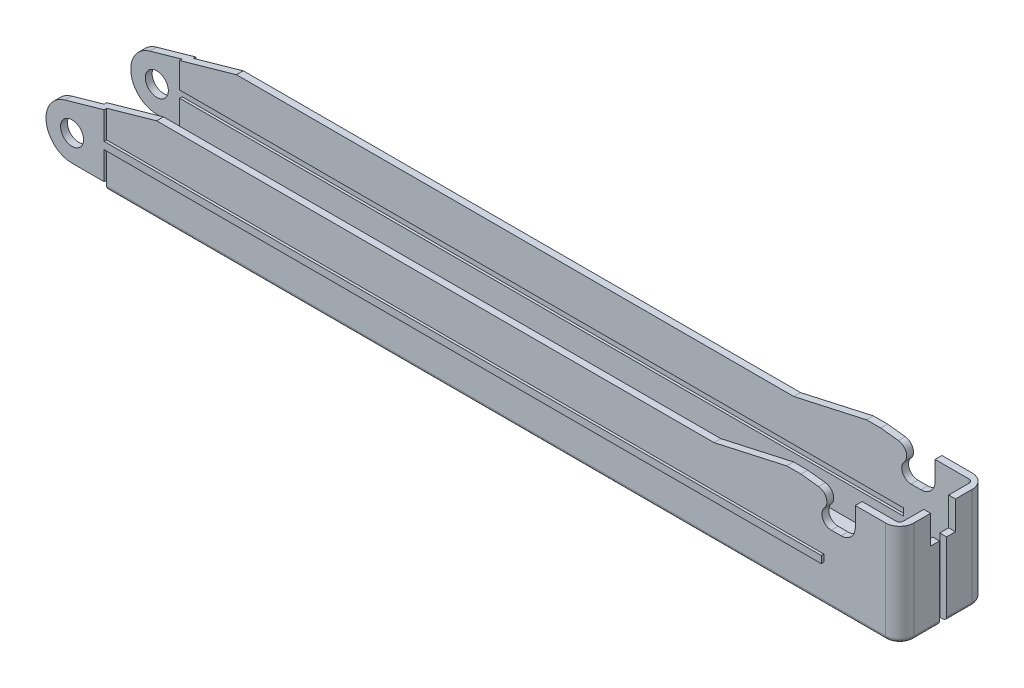
from build123d import *

# Parameters (mm, degrees)
BOSS_EXTRUDE1_DEPTH          = 7.747
BOSS_EXTRUDE2_DEPTH          = 8.1915
SHELL1_START                 = 1.2192
SHELL1_DEPTH                 = 16.9164
CUT_EXTRUDE1_DEPTH           = 1.2192
EXTRUDE_THIN1_START          = -16.383
SKETCH4_W                    = 128.27
SKETCH4_H                    = 1.27
EXTRUDE_THIN1_DEPTH          = 16.383
FILLET1_R                    = 2.54
SKETCH5_W                    = 13.9446
SKETCH5_H                    = 1.27
CUT_EXTRUDE2_DEPTH           = 129.4892
F_3_4_0_162_DIAMETER_HOLE1_D = 4.1148
CUT_EXTRUDE3_REACH           = 145.248
FILLET2_DEPTH                = 18.1356
CUT_EXTRUDE4_REACH           = 145.099
SKETCH9_R                    = 2.9591
FILLET3_R                    = 0.635
FILLET4_R                    = 2.54


with BuildPart() as part:
    # Sketch1 → Boss-Extrude1 (new, symmetric)
    with BuildSketch(Plane.XY):
        with BuildLine():
            Line((0, 0), (141.859, 0))
            Line((141.859, 0), (141.859, 18.1356))
            Line((141.859, 18.1356), (133.9088, 18.1356))
            Line((133.9088, 18.1356), (133.9088, 12.1666))
            Line((133.9088, 12.1666), (129.615181762, 12.1666))
            ThreePointArc((129.615181762, 12.1666), (128.080397702, 13.170161892), (128.3843, 14.978570578))
            ThreePointArc((128.3843, 14.978570578), (128.72346749, 16.699838275), (127.341060995, 17.78))
            Line((127.341060995, 17.78), (124.186037439, 18.1356))
            Line((124.186037439, 18.1356), (121.646037439, 18.1356))
            Line((121.646037439, 18.1356), (108.629212725, 15.24))
            Line((108.629212725, 15.24), (8.934212725, 15.24))
            Line((8.934212725, 15.24), (0, 12.7))
            Line((0, 12.7), (0, 0))
        make_face()
    extrude(amount=BOSS_EXTRUDE1_DEPTH, both=True)

    # Sketch2 → Boss-Extrude2 (add, symmetric)
    with BuildSketch(Plane.XY):
        with BuildLine():
            Line((0, 12.7), (-7.024172619, 10.703025112))
            ThreePointArc((-7.024172619, 10.703025112), (-10.369324418, 5.571014033), (-5.748264059, 1.5494))
            Line((-5.748264059, 1.5494), (0, 1.5494))
            Line((0, 1.5494), (0, 12.7))
        make_face()
    extrude(amount=BOSS_EXTRUDE2_DEPTH, both=True)

    # Shell1: read off the stored shape, not the designer's step
    # Shell1 outline → Shell1 (cut)
    with BuildSketch(Plane(origin=(0, 0, 0), x_dir=(1, 0, 0), z_dir=(0, 1, 0)).offset(SHELL1_START)):
        Polygon((140.6398, -6.5278), (140.6398, 6.5278), (-1.2192, 6.5278), (-1.2192, 6.9723), (-12, 6.9723), (-12, -6.9723), (-1.2192, -6.9723), (-1.2192, -6.5278), align=None)
    extrude(amount=SHELL1_DEPTH, mode=Mode.SUBTRACT)

    # Sketch3 → Cut-Extrude1 (cut)
    with BuildSketch(Plane(origin=(141.859, 0, 0), x_dir=(0, 0, -1), z_dir=(1, 0, 0))):
        Polygon((-2.2225, 13.0556), (-0.635, 13.0556), (-0.635, 0), (0.635, 0), (0.635, 13.0556), (2.2225, 13.0556), (2.2225, 18.1356), (-2.2225, 18.1356), align=None)
    extrude(amount=-CUT_EXTRUDE1_DEPTH, mode=Mode.SUBTRACT)

    # Sketch4 → Extrude-Thin1 (add)
    with BuildSketch(Plane.XY.offset(8.1915).offset(EXTRUDE_THIN1_START)):
        with Locations((64.135, 7.1628)):
            Rectangle(SKETCH4_W, SKETCH4_H)
    extrude_thin1 = extrude(amount=EXTRUDE_THIN1_DEPTH)

    # Fillet1
    fillet1_edges = [part.edges().sort_by_distance(p)[0] for p in [
        (141.859, 9.0678, 7.747),
        (141.859, 9.0678, -7.747),
    ]]
    fillet(fillet1_edges, radius=FILLET1_R)

    # Mirror2: Extrude-Thin1 across plane
    add(extrude_thin1.mirror(Plane.XY))

    # Sketch5 → Cut-Extrude2 (cut)
    with BuildSketch(Plane.ZY.offset(1.2192)):
        with Locations((0, 7.1628)):
            Rectangle(SKETCH5_W, SKETCH5_H)
    extrude(amount=-CUT_EXTRUDE2_DEPTH, mode=Mode.SUBTRACT)

    # 3/4 (0.162) Diameter Hole1 (through all)
    with Locations(Plane(origin=(0, 0, -8.1915), x_dir=(-1, 0, 0), z_dir=(0, 0, -1))):
        with Locations((5.748264059, 6.215135941)):
            Hole(F_3_4_0_162_DIAMETER_HOLE1_D / 2)

    # Sketch8 → Cut-Extrude3 (cut, up to next)
    with BuildSketch(Plane.XZ, mode=Mode.PRIVATE) as cut_extrude3_sk1:
        Polygon((140.6398, -6.5278), (140.6398, 6.5278), (140.0048, 6.5278), (140.0048, 4.064), (133.9088, 4.064), (133.9088, -4.064), (140.0048, -4.064), (140.0048, -6.5278), align=None)
    cut_extrude3_tool1 = extrude(cut_extrude3_sk1.sketch, amount=-CUT_EXTRUDE3_REACH, mode=Mode.PRIVATE) & part.part
    add(cut_extrude3_tool1.solids().sort_by_distance((137.439195, 0, 0))[0], mode=Mode.SUBTRACT)

    # Fillet2: read off the stored shape, not the designer's step
    # Fillet2 outline → Fillet2 (add)
    with BuildSketch(Plane(origin=(0, 0, 0), x_dir=(1, 0, 0), z_dir=(0, 1, 0))):
        with BuildLine():
            ThreePointArc((140.0048, 6.5278), (140.453812806, 6.341812806), (140.6398, 5.8928))
            Line((140.6398, 5.8928), (140.6398, 6.5278))
            Line((140.6398, 6.5278), (140.0048, 6.5278))
        make_face()
        with BuildLine():
            Line((140.6398, -6.5278), (140.6398, -5.8928))
            ThreePointArc((140.6398, -5.8928), (140.453812806, -6.341812806), (140.0048, -6.5278))
            Line((140.0048, -6.5278), (140.6398, -6.5278))
        make_face()
    extrude(amount=FILLET2_DEPTH)

    # Sketch9 → Cut-Extrude4 (cut, up to next)
    with BuildSketch(Plane(origin=(0, 1.2192, 0), x_dir=(1, 0, 0), z_dir=(0, 1, 0)), mode=Mode.PRIVATE) as cut_extrude4_sk1:
        with Locations(Location((119.9388, 0, 0), (0, 0, 270))):
            Circle(SKETCH9_R)
    cut_extrude4_tool1 = extrude(cut_extrude4_sk1.sketch, amount=-CUT_EXTRUDE4_REACH, mode=Mode.PRIVATE) & part.part
    # Sketch9 → Cut-Extrude4 (cut, up to next)
    with BuildSketch(Plane(origin=(0, 1.2192, 0), x_dir=(1, 0, 0), z_dir=(0, 1, 0)), mode=Mode.PRIVATE) as cut_extrude4_sk2:
        with Locations(Location((6.985, 0, 0), (0, 0, 270))):
            Circle(SKETCH9_R)
    cut_extrude4_tool2 = extrude(cut_extrude4_sk2.sketch, amount=-CUT_EXTRUDE4_REACH, mode=Mode.PRIVATE) & part.part
    add(cut_extrude4_tool1.solids().sort_by_distance((119.9388, 1.2192, 0))[0], mode=Mode.SUBTRACT)
    add(cut_extrude4_tool2.solids().sort_by_distance((6.985, 1.2192, 0))[0], mode=Mode.SUBTRACT)

    # Fillet3
    fillet3_edges = [part.edges().sort_by_distance(p)[0] for p in [
        (141.859, 0, -2.921),
        (69.6595, 0, -7.747),
        (141.859, 0, 2.921),
        (141.115051224, 0, 7.003051224),
        (141.115051224, 0, -7.003051224),
        (69.6595, 0, 7.747),
    ]]
    fillet(fillet3_edges, radius=FILLET3_R)

    # Fillet4
    fillet4_edges = [part.edges().sort_by_distance(p)[0] for p in [
        (133.9088, 12.1666, 7.1374),
        (133.9088, 12.1666, -7.1374),
    ]]
    fillet(fillet4_edges, radius=FILLET4_R)


solid = part.part
